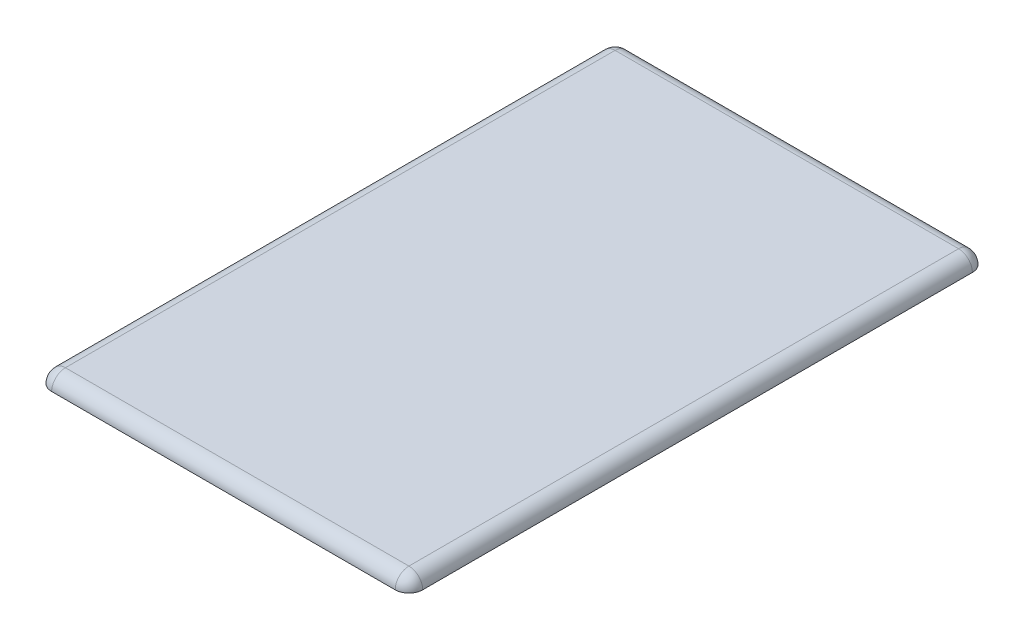
from build123d import *

# Parameters (mm, degrees)
SKETCH_1_W      = 24.8
SKETCH_1_H      = 39.8
EXTRUDE_1_DEPTH = 0.8
SKETCH_2_W      = 27
SKETCH_2_H      = 42
EXTRUDE_2_DEPTH = 1
FILLET_1_R      = 1


with BuildPart() as part:
    # ｽｹｯﾁ1 → ﾎﾞｽ - 押し出し1 (new body)
    with BuildSketch(Plane(origin=(0, 0, 0), x_dir=(1, 0, 0), z_dir=(0, 1, 0))):
        with Locations((5.315666607, 9.050036267)):
            Rectangle(SKETCH_1_W, SKETCH_1_H)
    extrude(amount=EXTRUDE_1_DEPTH)

    # ｽｹｯﾁ2 → ﾎﾞｽ - 押し出し2 (add)
    with BuildSketch(Plane(origin=(0, 0.8, 0), x_dir=(1, 0, 0), z_dir=(0, 1, 0))):
        with Locations((5.315666607, 9.050036267)):
            Rectangle(SKETCH_2_W, SKETCH_2_H)
    extrude(amount=EXTRUDE_2_DEPTH)

    # ﾌｨﾚｯﾄ1
    fillet_1_edges = [part.edges().sort_by_distance(p)[0] for p in [
        (-8.184333393, 1.3, -30.050036267),
        (-8.184333393, 1.3, 11.949963733),
        (18.815666607, 1.3, 11.949963733),
        (18.815666607, 1.3, -30.050036267),
        (-8.184333393, 1.8, -9.050036267),
        (5.315666607, 1.8, 11.949963733),
        (18.815666607, 1.8, -9.050036267),
        (5.315666607, 1.8, -30.050036267),
    ]]
    fillet(fillet_1_edges, radius=FILLET_1_R - 0.0001)  # a hair under: the kernel refuses the full size


solid = part.part
